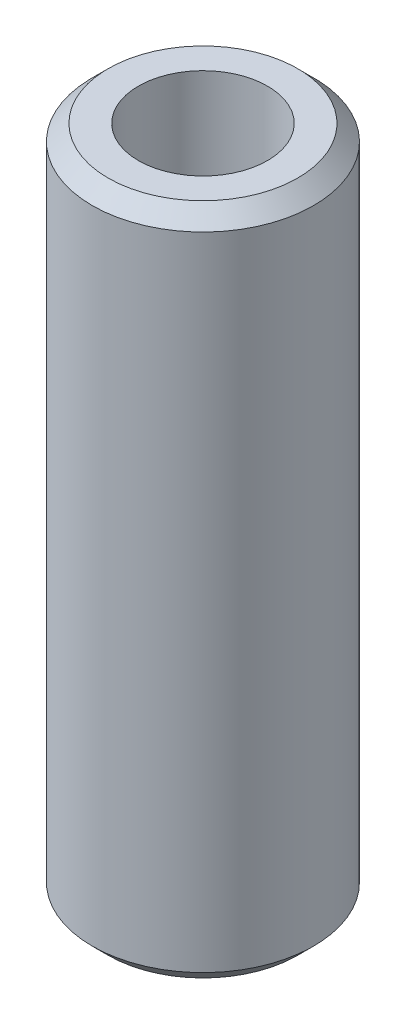
from build123d import *

# Parameters (mm, degrees)
SKETCH1_R           = 25
BOSS_EXTRUDE1_DEPTH = 152.026612046
SKETCH2_R           = 14.581060964
CUT_EXTRUDE1_DEPTH  = 157.083601862
CHAMFER1_SIZE       = 3.587119135


with BuildPart() as part:
    # Sketch1 → Boss-Extrude1 (new body)
    with BuildSketch(Plane(origin=(0, 0, 0), x_dir=(1, 0, 0), z_dir=(0, 1, 0))):
        Circle(SKETCH1_R)
    extrude(amount=BOSS_EXTRUDE1_DEPTH)

    # Sketch2 → Cut-Extrude1 (cut, through all)
    with BuildSketch(Plane(origin=(0, 0, 0), x_dir=(1, 0, 0), z_dir=(0, 1, 0))):
        Circle(SKETCH2_R)
    extrude(amount=CUT_EXTRUDE1_DEPTH, mode=Mode.SUBTRACT)

    # Chamfer1
    chamfer1_edges = [part.edges().sort_by_distance(p)[0] for p in [
        (-25, 152.026612046, 0),
        (-25, 0, 0),
    ]]
    chamfer(chamfer1_edges, length=CHAMFER1_SIZE)


solid = part.part
